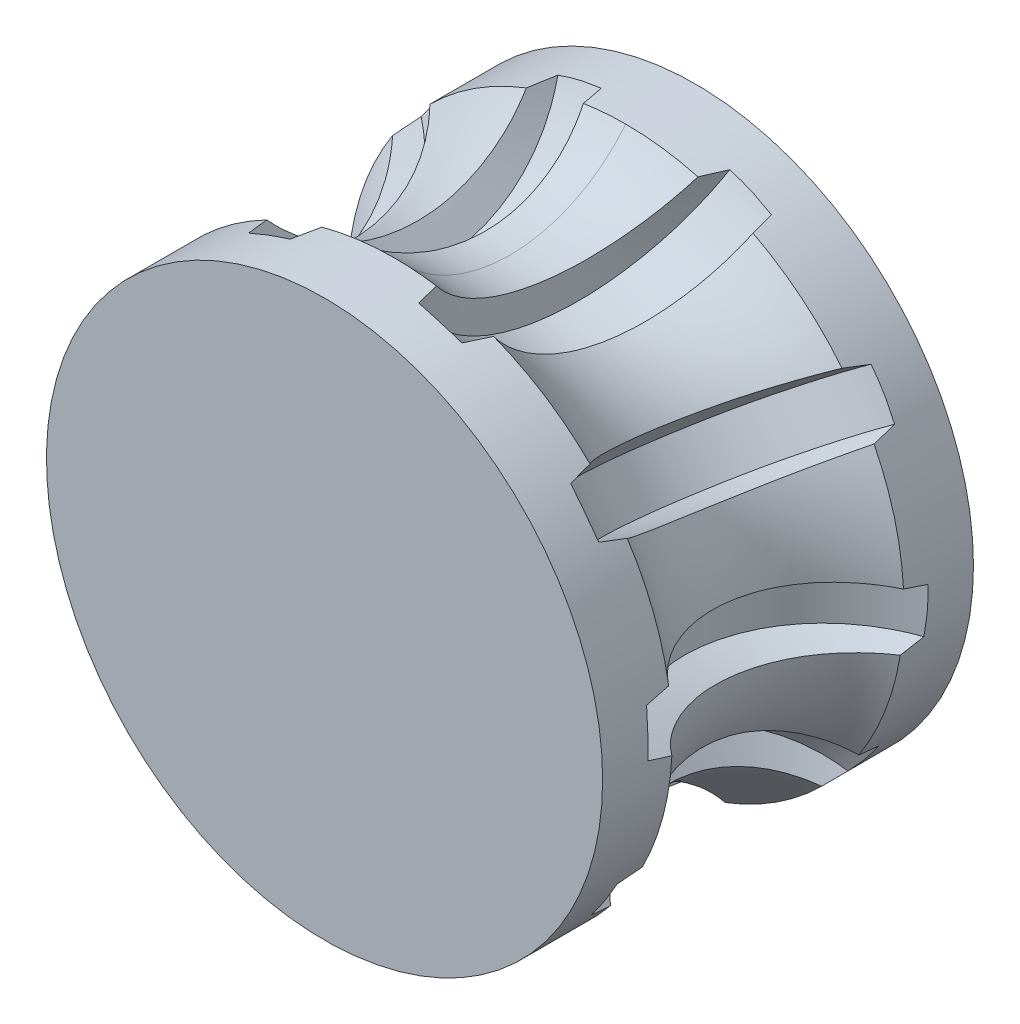
from build123d import *

# Parameters (mm, degrees)
SKETCH1_R           = 7.5
BOSS_EXTRUDE1_DEPTH = 5
CIRPATTERN1_COUNT   = 10


# Read off the part's stored shape, not the designer's step: Cut-Sweep1
with BuildPart() as part:
    # Sketch1 → Boss-Extrude1 (new, symmetric)
    with BuildSketch(Plane.XY):
        Circle(SKETCH1_R)
    extrude(amount=BOSS_EXTRUDE1_DEPTH, both=True)

    # Cut-Sweep1 outline → Cut-Sweep1 (revolve, cut)
    with BuildSketch(Plane.XZ):
        with BuildLine():
            ThreePointArc((7.5, 3.122498999), (6, 0), (7.5, -3.122498999))
            Line((7.5, -3.122498999), (7.5, 3.122498999))
        make_face()
    revolve(axis=Axis((0, 0, 0), (0, 0, 1)), mode=Mode.SUBTRACT)

    # Cut-Sweep2: sweep along a curve in space
    with BuildLine() as cut_sweep2_path:
        add(Edge.make_bspline(
            [(9.25, 0, 4), (8.729726136, -0.051752598, 4), (7.677904054, -0.156403434, 3.791727486), (6.348344228, -0.312459084, 2.902062578), (5.458156283, -0.468760229, 1.57058495), (5.145921858, -0.625, 0), (5.458156283, -0.781239771, -1.57058495), (6.348344228, -0.937540916, -2.902062578), (7.677904054, -1.093596566, -3.791727486), (8.729726136, -1.198247402, -4), (9.25, -1.25, -4)],
            knots=[0, 0, 0, 0, 0.125, 0.25, 0.375, 0.5, 0.625, 0.75, 0.875, 1, 1, 1, 1], degree=3))
    # Sketch4 → Cut-Sweep2 (sweep, cut)
    with BuildSketch(Plane.XY):
        Polygon((5.088621884, 0.625), (5.088621884, -0.625), (7.088621884, -1.25), (7.088621884, 1.25), align=None)
    cut_sweep2 = sweep(path=cut_sweep2_path.line, is_frenet=True, mode=Mode.SUBTRACT)

    # CirPattern1: Cut-Sweep2 ×10 about axis
    cirpattern1_axis = Axis((0, 0, 5), (0, 0, 1))
    for i in range(1, CIRPATTERN1_COUNT):
        add(cut_sweep2.rotate(cirpattern1_axis, i * 360 / CIRPATTERN1_COUNT), mode=Mode.SUBTRACT)


solid = part.part
